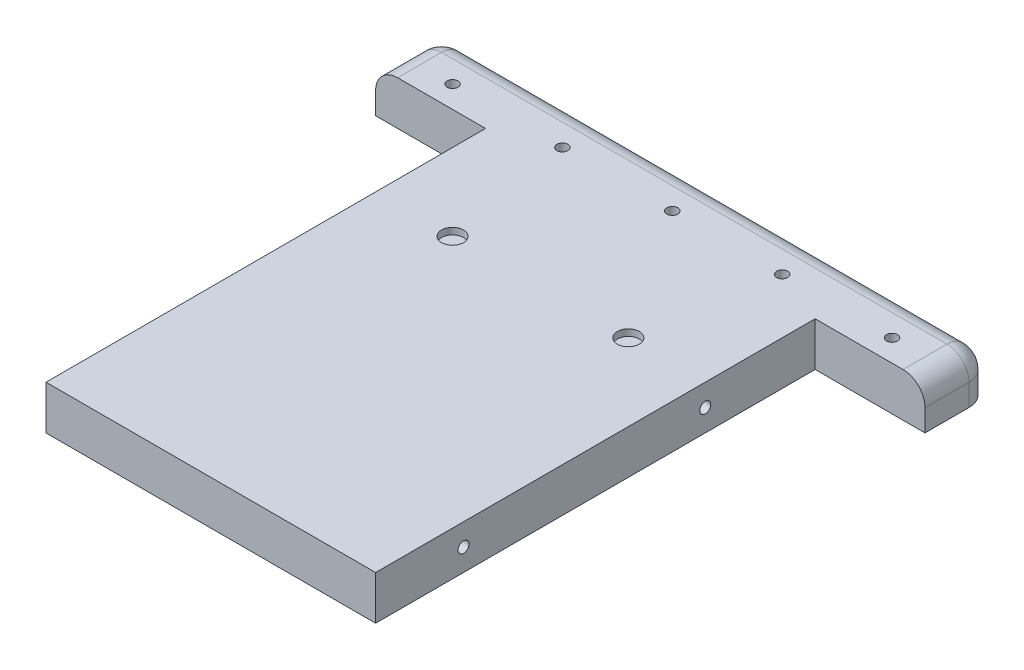
from build123d import *

# Parameters (mm, degrees)
BOSS_EXTRUDE1_DEPTH = 20
SKETCH2_R           = 2.5
CUT_EXTRUDE1_DEPTH  = 240.374184072
SKETCH4_R           = 2.5
CUT_EXTRUDE2_DEPTH  = 5
FILLET1_R           = 10
FILLET2_R           = 10
SKETCH6_R           = 2.5
CUT_EXTRUDE3_DEPTH  = 5
SKETCH8_R           = 5
CUT_EXTRUDE5_DEPTH  = 3


with BuildPart() as part:
    # Sketch1 → Boss-Extrude1 (new body)
    with BuildSketch(Plane(origin=(0, 0, 0), x_dir=(1, 0, 0), z_dir=(0, 1, 0))):
        Polygon((-75, -100), (75, -100), (75, 100), (125, 100), (125, 130), (-125, 130), (-125, 100), (-75, 100), align=None)
    extrude(amount=BOSS_EXTRUDE1_DEPTH)

    # Sketch2 → Cut-Extrude1 (cut, through all)
    with BuildSketch(Plane.ZY.offset(75)):
        with Locations((60, 10)):
            Circle(SKETCH2_R)
        with Locations((-50, 10)):
            Circle(SKETCH2_R)
    extrude(amount=-CUT_EXTRUDE1_DEPTH, mode=Mode.SUBTRACT)

    # Sketch4 → Cut-Extrude2 (cut)
    with BuildSketch(Plane.XZ):
        with Locations((-100, -115)):
            Circle(SKETCH4_R)
        with Locations((-50, -115)):
            Circle(SKETCH4_R)
        with Locations((0, -115)):
            Circle(SKETCH4_R)
        with Locations((50, -115)):
            Circle(SKETCH4_R)
        with Locations((100, -115)):
            Circle(SKETCH4_R)
    extrude(amount=-CUT_EXTRUDE2_DEPTH, mode=Mode.SUBTRACT)

    # Fillet1
    fillet1_edges = [part.edges().sort_by_distance(p)[0] for p in [
        (125, 10, -130),
        (-125, 10, -130),
    ]]
    fillet(fillet1_edges, radius=FILLET1_R)

    # Fillet2
    fillet2_edges = [part.edges().sort_by_distance(p)[0] for p in [
        (125, 20, -110),
        (122.071067812, 20, -127.071067812),
        (-125, 20, -110),
        (-122.071067812, 20, -127.071067812),
        (0, 20, -130),
    ]]
    fillet(fillet2_edges, radius=FILLET2_R)

    # Sketch6 → Cut-Extrude3 (cut)
    with BuildSketch(Plane(origin=(0, 20, 0), x_dir=(1, 0, 0), z_dir=(0, 1, 0))):
        with Locations((0, 110)):
            Circle(SKETCH6_R)
        with Locations((50, 110)):
            Circle(SKETCH6_R)
        with Locations((100, 110)):
            Circle(SKETCH6_R)
        with Locations((-50, 110)):
            Circle(SKETCH6_R)
        with Locations((-100, 110)):
            Circle(SKETCH6_R)
    extrude(amount=-CUT_EXTRUDE3_DEPTH, mode=Mode.SUBTRACT)

    # Sketch8 → Cut-Extrude5 (cut)
    with BuildSketch(Plane(origin=(0, 20, 0), x_dir=(1, 0, 0), z_dir=(0, 1, 0))):
        with Locations((-40, 50)):
            Circle(SKETCH8_R)
        with Locations((40, 50)):
            Circle(SKETCH8_R)
    extrude(amount=-CUT_EXTRUDE5_DEPTH, mode=Mode.SUBTRACT)


solid = part.part
